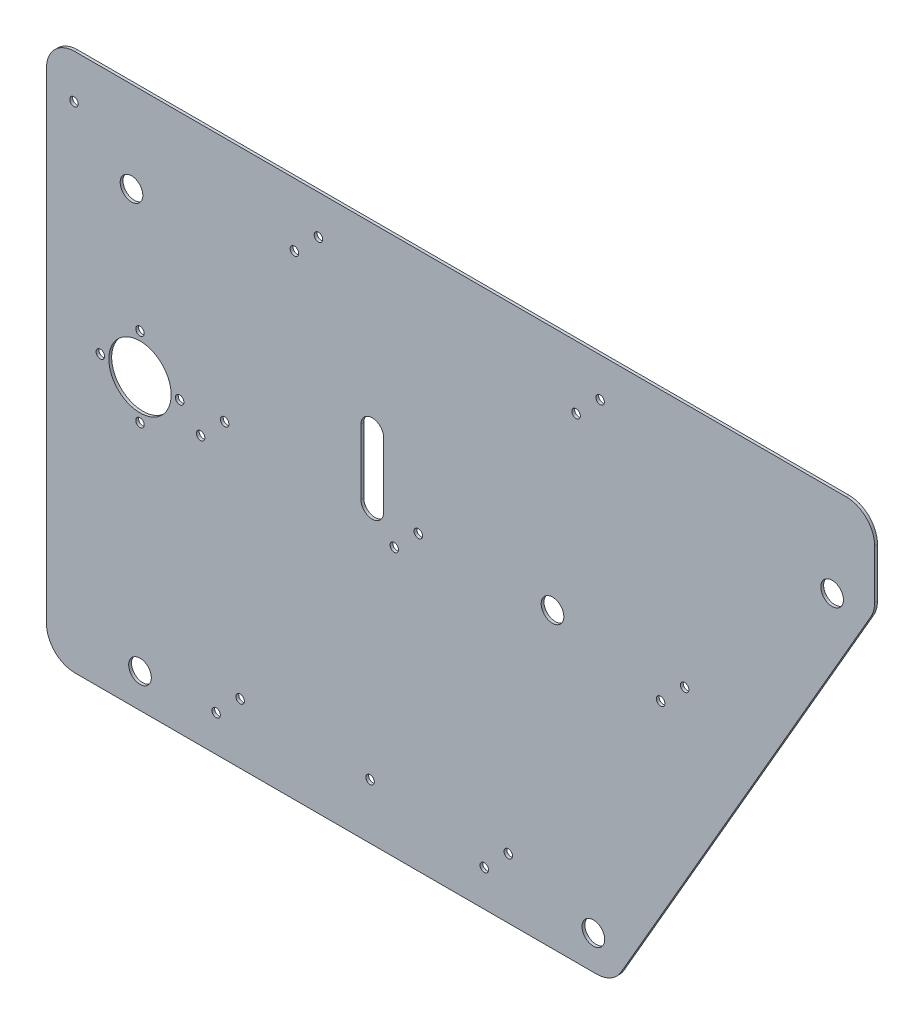
from build123d import *

# Parameters (mm, degrees)
BOSS_EXTRUDE1_DEPTH = 1
FILLET1_R           = 10
SKETCH2_R           = 4
SKETCH2_R_2         = 11
SKETCH2_R_3         = 1.5
CUT_EXTRUDE1_DEPTH  = 3


with BuildPart() as part:
    # Sketch1 → Boss-Extrude1 (new body)
    with BuildSketch(Plane.XY):
        Polygon((-100, 110), (-100, -80), (100, -80), (192.37604307, 80), (192.37604307, 110), align=None)
    extrude(amount=BOSS_EXTRUDE1_DEPTH)

    # Fillet1
    fillet1_edges = [part.edges().sort_by_distance(p)[0] for p in [
        (100, -80, 0.5),
        (-100, -80, 0.5),
        (192.37604307, 110, 0.5),
        (192.37604307, 80, 0.5),
        (-100, 110, 0.5),
    ]]
    fillet(fillet1_edges, radius=FILLET1_R)

    # Sketch2 → Cut-Extrude1 (cut)
    with BuildSketch(Plane.XY.offset(1)):
        with Locations((93.07179677, -68)):
            Circle(SKETCH2_R)
        with Locations((177.364936071, 78)):
            Circle(SKETCH2_R)
        with Locations((-67, 22)):
            Circle(SKETCH2_R_2)
        with Locations((-67, -68)):
            Circle(SKETCH2_R)
        with Locations((-53, 22)):
            Circle(SKETCH2_R_3)
        with Locations((-67, 36)):
            Circle(SKETCH2_R_3)
        with Locations((-81, 22)):
            Circle(SKETCH2_R_3)
        with Locations((-67, 8)):
            Circle(SKETCH2_R_3)
        with Locations((-70, 78)):
            Circle(SKETCH2_R)
        with Locations((54.54952947, -67.242640687)):
            Circle(SKETCH2_R_3)
        with Locations((63.034810844, -58.757359313)):
            Circle(SKETCH2_R_3)
        with Locations((14.225855729, -60.5)):
            Circle(SKETCH2_R_3)
        with Locations((-40.127135228, -67.242640687)):
            Circle(SKETCH2_R_3)
        with Locations((-31.641853854, -58.757359313)):
            Circle(SKETCH2_R_3)
        with Locations((-90.295627115, 94.5)):
            Circle(SKETCH2_R_3)
        with Locations((-12.482801161, 87.757359313)):
            Circle(SKETCH2_R_3)
        with Locations((-3.997519787, 96.242640687)):
            Circle(SKETCH2_R_3)
        with Locations((86.965374539, 87.757359313)):
            Circle(SKETCH2_R_3)
        with Locations((95.450655913, 96.242640687)):
            Circle(SKETCH2_R_3)
        with Locations((22.762645068, 14.757359313)):
            Circle(SKETCH2_R_3)
        with Locations((31.247926442, 23.242640687)):
            Circle(SKETCH2_R_3)
        with Locations((-45.601368119, 14.757359313)):
            Circle(SKETCH2_R_3)
        with Locations((-37.116086745, 23.242640687)):
            Circle(SKETCH2_R_3)
        with Locations((116.811272287, 14.757359313)):
            Circle(SKETCH2_R_3)
        with Locations((125.296553661, 23.242640687)):
            Circle(SKETCH2_R_3)
        with Locations((78.638243285, 23.5)):
            Circle(SKETCH2_R)
        with BuildLine():
            Line((11, 23.5), (11, 46.5))
            ThreePointArc((11, 46.5), (15, 50.5), (19, 46.5))
            Line((19, 46.5), (19, 23.5))
            ThreePointArc((19, 23.5), (15, 19.5), (11, 23.5))
        make_face()
    extrude(amount=-CUT_EXTRUDE1_DEPTH, mode=Mode.SUBTRACT)


solid = part.part
